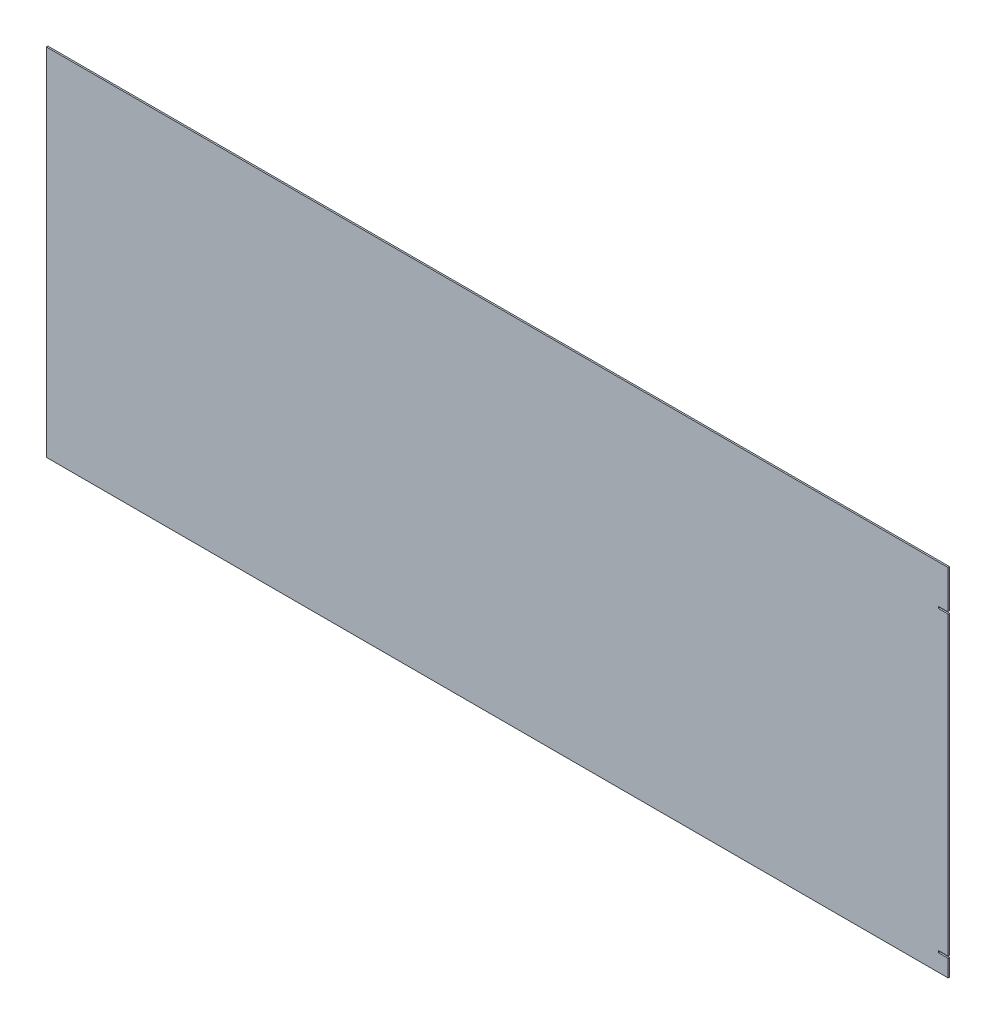
from build123d import *

# Parameters (mm, degrees)
SKETCH1_W          = 1200
SKETCH1_H          = 473
BASE_FLANGE1_DEPTH = 2
SKETCH2_W          = 2
SKETCH2_H          = 2.5
CUT_EXTRUDE1_DEPTH = 13
FILLET1_R          = 0.74


# Sheet-metal steps are written as plain solids
with BuildPart() as part:
    # Sketch1 → Base-Flange1 (new body)
    with BuildSketch(Plane.XY):
        Rectangle(SKETCH1_W, SKETCH1_H)
    extrude(amount=-BASE_FLANGE1_DEPTH)

    # Sketch2 → Cut-Extrude1 (cut)
    with BuildSketch(Plane(origin=(600, 0, 0), x_dir=(0, 0, -1), z_dir=(1, 0, 0))):
        with Locations((1, 184.060514082)):
            Rectangle(SKETCH2_W, SKETCH2_H)
        with Locations((1, -212.570674279)):
            Rectangle(SKETCH2_W, SKETCH2_H)
    extrude(amount=-CUT_EXTRUDE1_DEPTH, mode=Mode.SUBTRACT)

    # Fillet1
    fillet1_edges = [part.edges().sort_by_distance(p)[0] for p in [
        (600, 185.310514082, -1),
        (600, -213.820674279, -1),
    ]]
    fillet(fillet1_edges, radius=FILLET1_R)


solid = part.part
